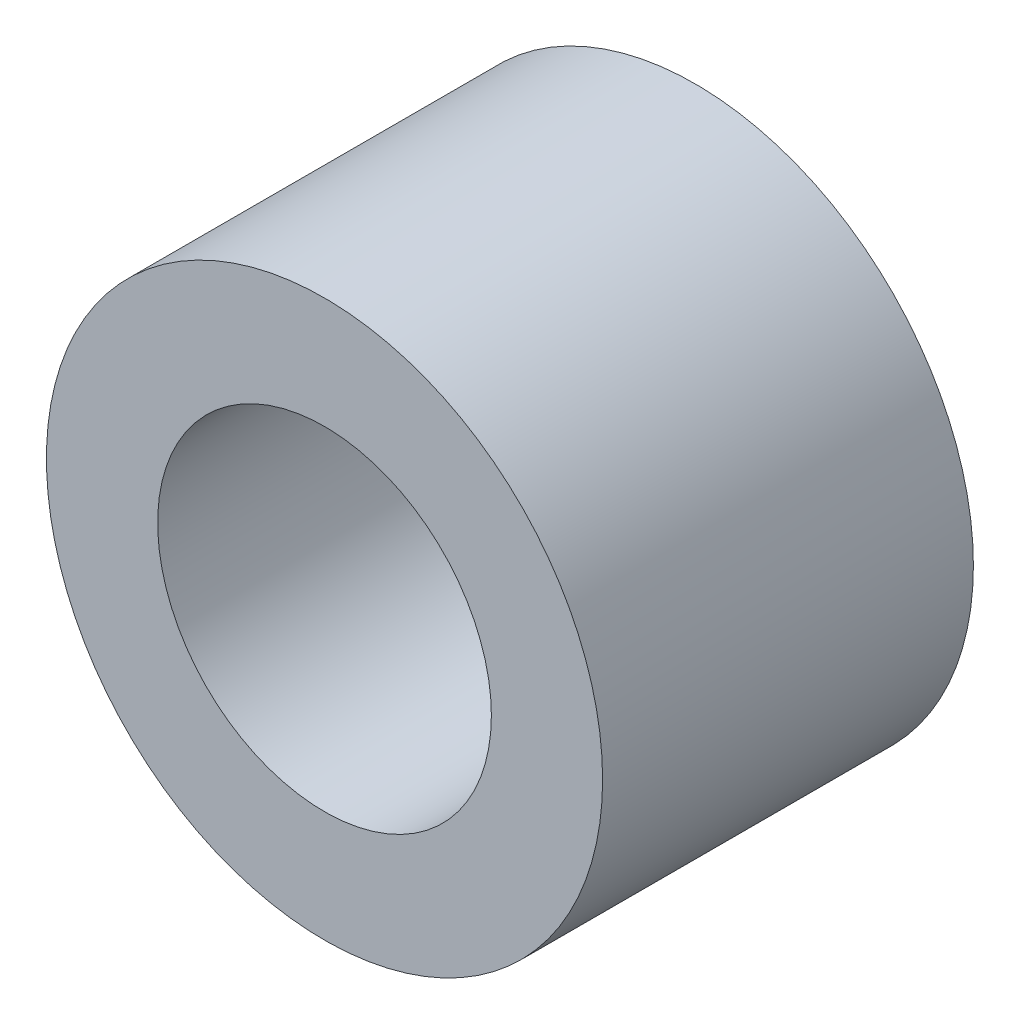
from build123d import *

# Parameters (mm, degrees)
SKETCH1_R      = 2.25
SKETCH1_R_2    = 1.35
EXTRUDE1_DEPTH = 1.5


with BuildPart() as part:
    # Sketch1 → Extrude1 (new, symmetric)
    with BuildSketch(Plane.XY):
        Circle(SKETCH1_R)
        Circle(SKETCH1_R_2, mode=Mode.SUBTRACT)
    extrude(amount=EXTRUDE1_DEPTH, both=True)


solid = part.part
